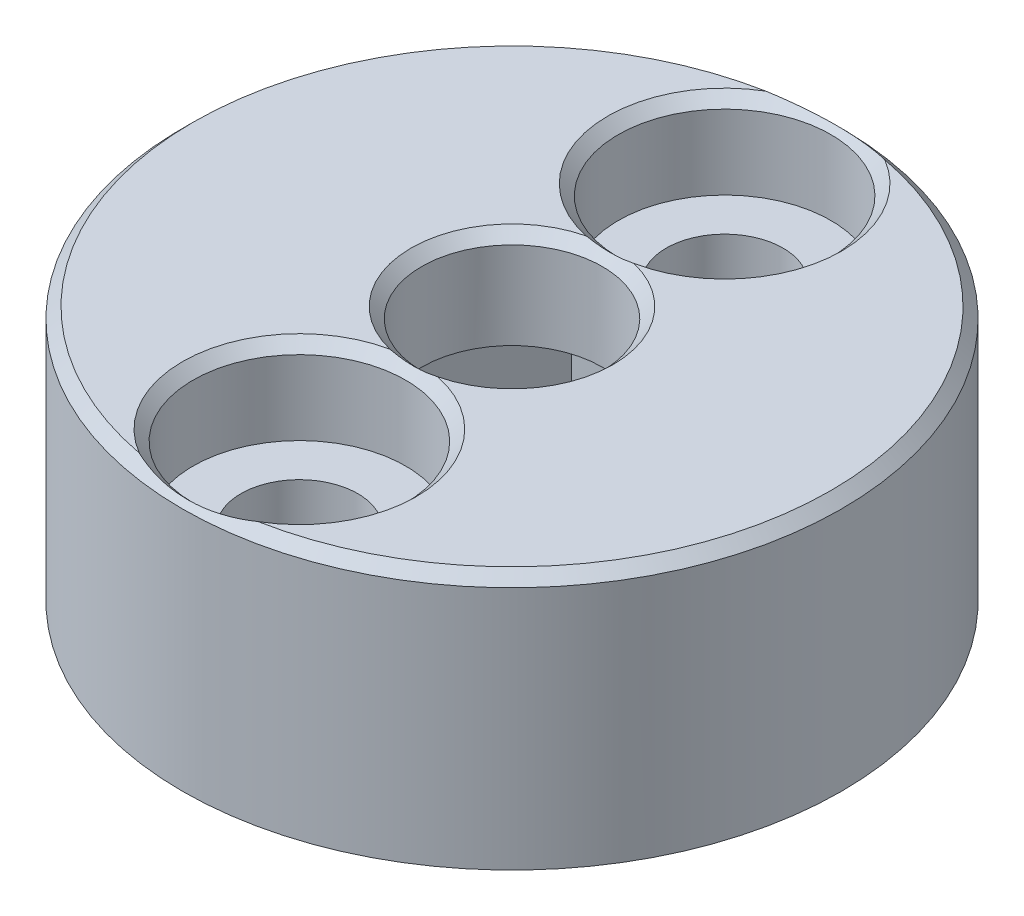
from build123d import *

# Parameters (mm, degrees)
SKETCH1_R           = 15.5
BOSS_EXTRUDE1_DEPTH = 12
SKETCH2_R           = 2.75
CUT_EXTRUDE1_DEPTH  = 25.989997999
SKETCH3_R           = 4.25
CUT_EXTRUDE2_DEPTH  = 25.989997999
CUT_EXTRUDE3_DEPTH  = 7.4
SKETCH5_R           = 5
CUT_EXTRUDE4_DEPTH  = 4
CHAMFER1_SIZE       = 0.5


with BuildPart() as part:
    # Sketch1 → Boss-Extrude1 (new body)
    with BuildSketch(Plane(origin=(0, 0, 0), x_dir=(1, 0, 0), z_dir=(0, 1, 0))):
        with Locations(Location((0, 0, 0), (0, 0, 270))):
            Circle(SKETCH1_R)
    extrude(amount=BOSS_EXTRUDE1_DEPTH)

    # Sketch2 → Cut-Extrude1 (cut, through all)
    with BuildSketch(Plane(origin=(0, 12, 0), x_dir=(1, 0, 0), z_dir=(0, 1, 0))):
        with Locations(Location((0, 10, 0), (0, 0, 270))):
            Circle(SKETCH2_R)
        with Locations(Location((0, -10, 0), (0, 0, 270))):
            Circle(SKETCH2_R)
    extrude(amount=-CUT_EXTRUDE1_DEPTH, mode=Mode.SUBTRACT)

    # Sketch3 → Cut-Extrude2 (cut, through all)
    with BuildSketch(Plane(origin=(0, 12, 0), x_dir=(1, 0, 0), z_dir=(0, 1, 0))):
        with Locations(Location((0, 0, 0), (0, 0, 270))):
            Circle(SKETCH3_R)
    extrude(amount=-CUT_EXTRUDE2_DEPTH, mode=Mode.SUBTRACT)

    # Sketch4 → Cut-Extrude3 (cut)
    with BuildSketch(Plane.XZ):
        Polygon((3.798941201, -6.539983111), (7.563262114, 0.019988032), (3.764320914, 6.559971143), (-3.798941201, 6.539983111), (-7.563262114, -0.019988032), (-3.764320914, -6.559971143), align=None)
    extrude(amount=-CUT_EXTRUDE3_DEPTH, mode=Mode.SUBTRACT)

    # Sketch5 → Cut-Extrude4 (cut)
    with BuildSketch(Plane(origin=(0, 12, 0), x_dir=(1, 0, 0), z_dir=(0, 1, 0))):
        with Locations(Location((0, 10, 0), (0, 0, 270))):
            Circle(SKETCH5_R)
        with Locations(Location((0, -10, 0), (0, 0, 270))):
            Circle(SKETCH5_R)
    extrude(amount=-CUT_EXTRUDE4_DEPTH, mode=Mode.SUBTRACT)

    # Chamfer1
    # the kernel refuses this chamfer: 0.5 mm, written as the material it takes off along each edge
    with BuildSketch(Plane(origin=(0, 12, 0), x_dir=(0, 0, 1), z_dir=(-1, 0, 0))) as chamfer1_piece_1:
        Polygon((4.25 + CHAMFER1_SIZE, 0), (4.25, -CHAMFER1_SIZE), (4.25, 0), align=None)
    revolve(axis=Axis((0, 12, 0), (0, 1, 0)), mode=Mode.SUBTRACT)
    with BuildSketch(Plane(origin=(0, 12, 0), x_dir=(0, 0, 1), z_dir=(-1, 0, 0))) as chamfer1_piece_2:
        Polygon((15.5, -CHAMFER1_SIZE), (15.5 - CHAMFER1_SIZE, 0), (15.5, 0), align=None)
    revolve(axis=Axis((0, 12, 0), (0, 1, 0)), mode=Mode.SUBTRACT)
    with BuildSketch(Plane(origin=(0, 12, -10), x_dir=(0, 0, 1), z_dir=(-1, 0, 0))) as chamfer1_piece_3:
        Polygon((5 + CHAMFER1_SIZE, 0), (5, -CHAMFER1_SIZE), (5, 0), align=None)
    revolve(axis=Axis((0, 12, -10), (0, 1, 0)), mode=Mode.SUBTRACT)
    with BuildSketch(Plane(origin=(0, 12, 10), x_dir=(0, 0, 1), z_dir=(-1, 0, 0))) as chamfer1_piece_4:
        Polygon((5 + CHAMFER1_SIZE, 0), (5, -CHAMFER1_SIZE), (5, 0), align=None)
    revolve(axis=Axis((0, 12, 10), (0, 1, 0)), mode=Mode.SUBTRACT)


solid = part.part
